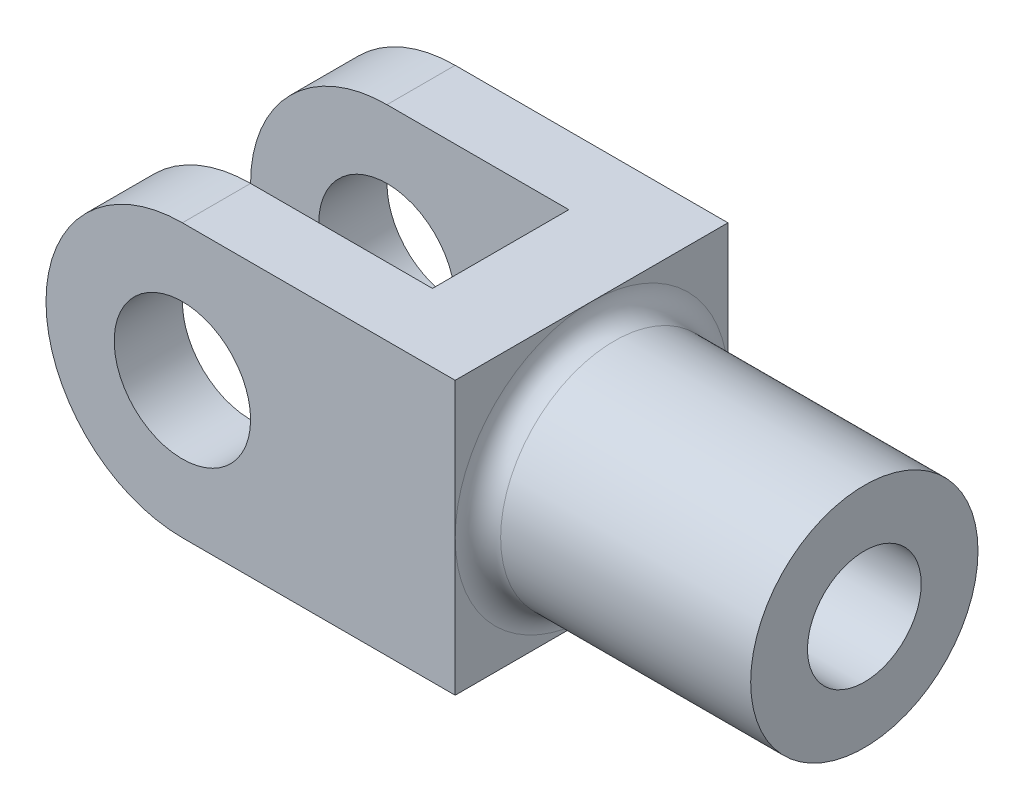
from build123d import *

# Parameters (mm, degrees)
SKETCH1_R               = 3
BOSS_EXTRUDE1_DEPTH     = 6
CUT_EXTRUDE1_DEPTH      = 15.696938457
CUT_EXTRUDE1_DEPTH_BACK = 15.696938457
SKETCH2_W               = 14
SKETCH2_H               = 6
SKETCH3_R               = 5
SKETCH3_R_2             = 2.5
BOSS_EXTRUDE2_DEPTH     = 12
FILLET1_R               = 1


with BuildPart() as part:
    # Sketch1 → Boss-Extrude1 (new, symmetric)
    with BuildSketch(Plane.XY):
        with BuildLine():
            Line((0, -6), (12, -6))
            Line((12, -6), (12, 6))
            Line((12, 6), (0, 6))
            ThreePointArc((0, 6), (-6, 0), (0, -6))
        make_face()
        Circle(SKETCH1_R, mode=Mode.SUBTRACT)
    extrude(amount=BOSS_EXTRUDE1_DEPTH, both=True)

    # Sketch2 → Cut-Extrude1 (cut, two sides: drawn at the far end of the back side and taken through both)
    with BuildSketch(Plane(origin=(0, 0, 0), x_dir=(1, 0, 0), z_dir=(0, 1, 0)).offset(-CUT_EXTRUDE1_DEPTH_BACK)):
        with Locations((1, 0)):
            Rectangle(SKETCH2_W, SKETCH2_H)
    extrude(amount=CUT_EXTRUDE1_DEPTH + CUT_EXTRUDE1_DEPTH_BACK, mode=Mode.SUBTRACT)

    # Sketch3 → Boss-Extrude2 (add)
    with BuildSketch(Plane(origin=(12, 0, 0), x_dir=(0, 0, -1), z_dir=(1, 0, 0))):
        with Locations(Location((0, 0, 0), (0, 0, 180))):
            Circle(SKETCH3_R)
        Circle(SKETCH3_R_2, mode=Mode.SUBTRACT)
    extrude(amount=BOSS_EXTRUDE2_DEPTH)

    # Fillet1
    fillet1_edges = [part.edges().sort_by_distance(p)[0] for p in [
        (12, 0, -5),
    ]]
    fillet(fillet1_edges, radius=FILLET1_R - 0.0001)  # a hair under: the kernel refuses the full size


solid = part.part
